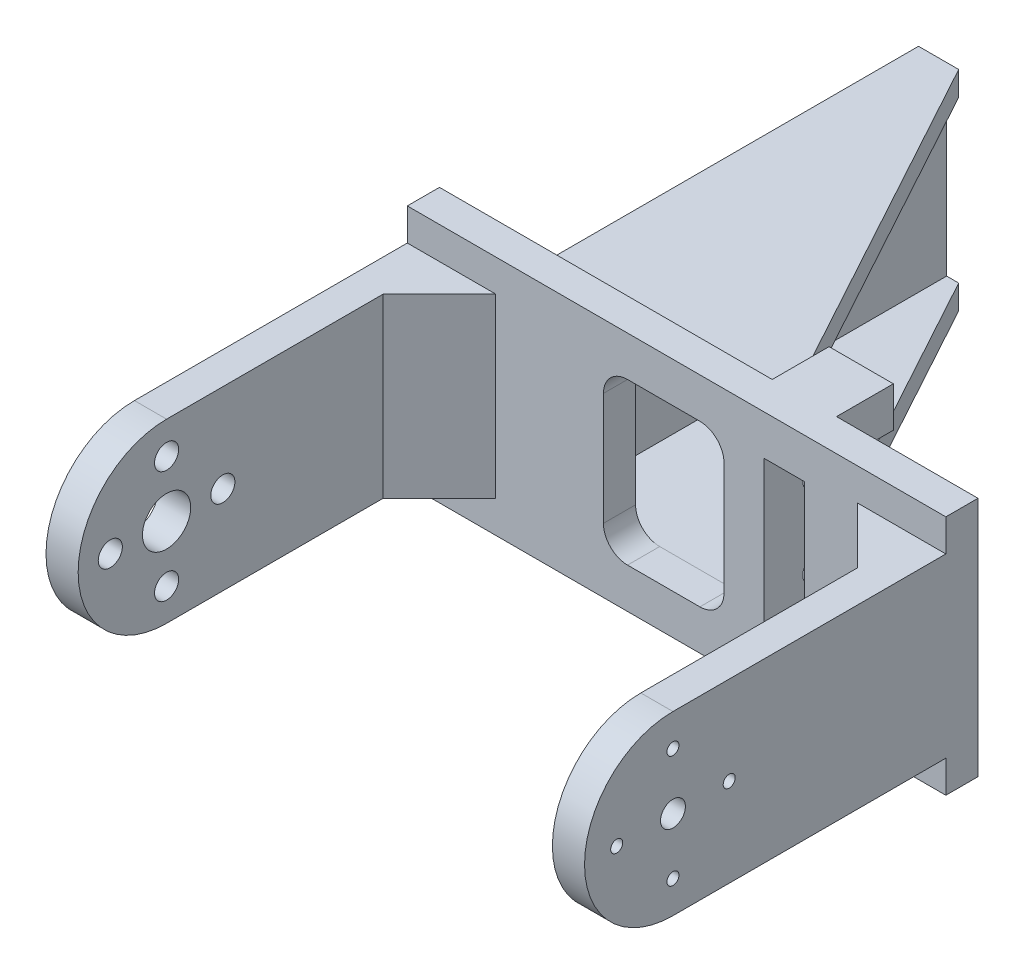
from build123d import *

# Parameters (mm, degrees)
BOSS_EXTRUDE1_DEPTH      = 22
SKETCH3_R                = 1.55
CUT_EXTRUDE1_DEPTH       = 30
CUT_EXTRUDE5_DEPTH       = 9
SKETCH11_R               = 0.75
CUT_EXTRUDE10_DEPTH      = 13
CUT_EXTRUDE11_START      = -10
CUT_EXTRUDE11_DEPTH      = 10
SKETCH13_R               = 3
SKETCH13_R_2             = 1.5
CUT_EXTRUDE12_DEPTH      = 4
FILLET1_SIZE             = 7
SKETCH14_W               = 54
SKETCH14_H               = 9.3
SKETCH14_W_2             = 7.05
SKETCH14_H_2             = 4
BOSS_EXTRUDE4_DEPTH      = 4
SKETCH17_W               = 7.05
SKETCH17_H               = 4
BOSS_EXTRUDE5_DEPTH      = 23.05
BOSS_EXTRUDE6_DEPTH      = 27.3
BOSS_EXTRUDE6_DEPTH_BACK = 4
SKETCH18_W               = 54
SKETCH18_H               = 2.95
SKETCH19_W               = 54
SKETCH19_H               = 2.8
BOSS_EXTRUDE7_DEPTH      = 21
FILLET2_SIZE             = 6.5
FILLET3_SIZE             = 0.5
SKETCH20_R               = 3.970030919
BOSS_EXTRUDE8_DEPTH      = 6
FILLET4_R                = 1
CUT_EXTRUDE13_START      = -37.3
CUT_EXTRUDE13_DEPTH      = 37.3
SKETCH22_W               = 56.118071471
SKETCH22_H               = 11.813110758
CUT_EXTRUDE14_DEPTH      = 56
BOSS_EXTRUDE9_DEPTH      = 4
BOSS_EXTRUDE9_DEPTH_BACK = 26
SKETCH23_W               = 67
SKETCH23_H               = 4
SKETCH25_W               = 5
SKETCH25_H               = 30
BOSS_EXTRUDE10_DEPTH     = 7.07
SKETCH26_W               = 5
SKETCH26_H               = 5
BOSS_EXTRUDE11_DEPTH     = 7.07
SKETCH27_R               = 1.5
CUT_EXTRUDE15_DEPTH      = 7.07
SKETCH28_W               = 5
SKETCH28_H               = 20
SKETCH28_W_2             = 15
CUT_EXTRUDE16_DEPTH      = 7.07
SKETCH29_W               = 3.5
SKETCH29_H               = 30
BOSS_EXTRUDE12_DEPTH     = 47
SKETCH31_W               = 3.5
SKETCH31_H               = 2
CUT_EXTRUDE18_DEPTH      = 47
FILLET8_R                = 3
SKETCH34_W               = 47
SKETCH34_H               = 2.99
BOSS_EXTRUDE14_DEPTH     = 23.3
CUT_EXTRUDE19_DEPTH      = 38
CUT_EXTRUDE20_DEPTH      = 7.07
SKETCH37_R               = 2.5
BOSS_EXTRUDE15_DEPTH     = 7
FILLET10_R               = 0.5


# Read off the part's stored shape, not the designer's step: Cut-Extrude13
with BuildPart() as part:
    # Sketch1 → Boss-Extrude1 (new body)
    with BuildSketch(Plane(origin=(0, 0, 0), x_dir=(1, 0, 0), z_dir=(0, 1, 0))):
        Polygon((0, 0), (0, 50), (67, 50), (67, 0), (63, 0), (63, 46), (4, 46), (4, 0), align=None)
    extrude(amount=BOSS_EXTRUDE1_DEPTH)

    # Sketch3 → Cut-Extrude1 (cut)
    with BuildSketch(Plane(origin=(67, 0, 0), x_dir=(0, 0, -1), z_dir=(1, 0, 0))):
        with Locations((12.05, 11)):
            Circle(SKETCH3_R)
    extrude(amount=-CUT_EXTRUDE1_DEPTH, mode=Mode.SUBTRACT)

    # Sketch5 → Cut-Extrude5 (cut)
    with BuildSketch(Plane(origin=(67, 0, 0), x_dir=(0, 0, -1), z_dir=(1, 0, 0))):
        with BuildLine():
            Line((12.05, 22), (0, 22))
            Line((0, 22), (0, 0))
            Line((0, 0), (12.05, 0))
            ThreePointArc((12.05, 0), (1.05, 11), (12.05, 22))
        make_face()
    extrude(amount=-CUT_EXTRUDE5_DEPTH, mode=Mode.SUBTRACT)

    # Sketch11 → Cut-Extrude10 (cut)
    with BuildSketch(Plane(origin=(67, 0, 0), x_dir=(0, 0, -1), z_dir=(1, 0, 0))):
        with Locations((19.05, 11)):
            Circle(SKETCH11_R)
        with Locations((12.05, 18)):
            Circle(SKETCH11_R)
        with Locations((12.05, 4)):
            Circle(SKETCH11_R)
        with Locations((5.05, 11)):
            Circle(SKETCH11_R)
    extrude(amount=-CUT_EXTRUDE10_DEPTH, mode=Mode.SUBTRACT)

    # Sketch12 → Cut-Extrude11 (cut)
    with BuildSketch(Plane.ZY.offset(CUT_EXTRUDE11_START)):
        with BuildLine():
            Line((-12.05, 22), (0, 22))
            Line((0, 22), (0, 0))
            Line((0, 0), (-12.05, 0))
            ThreePointArc((-12.05, 0), (-1.05, 11), (-12.05, 22))
        make_face()
    extrude(amount=CUT_EXTRUDE11_DEPTH, mode=Mode.SUBTRACT)

    # Sketch13 → Cut-Extrude12 (cut)
    with BuildSketch(Plane.ZY):
        with Locations((-12.05, 11)):
            Circle(SKETCH13_R)
        with Locations((-19.05, 11)):
            Circle(SKETCH13_R_2)
        with Locations((-12.05, 4)):
            Circle(SKETCH13_R_2)
        with Locations((-5.05, 11)):
            Circle(SKETCH13_R_2)
        with Locations((-12.05, 18)):
            Circle(SKETCH13_R_2)
    extrude(amount=-CUT_EXTRUDE12_DEPTH, mode=Mode.SUBTRACT)

    # Fillet1
    fillet1_edges = [part.edges().sort_by_distance(p)[0] for p in [
        (63, 11, -46),
        (4, 11, -46),
    ]]
    chamfer(fillet1_edges, length=FILLET1_SIZE)

    # Sketch14 → Boss-Extrude4 (add)
    with BuildSketch(Plane(origin=(0, 0, -50), x_dir=(-1, 0, 0), z_dir=(0, 0, -1))):
        with Locations((-33.5, -4.65)):
            Rectangle(SKETCH14_W, SKETCH14_H)
        with Locations((-56.975, 20)):
            Rectangle(SKETCH14_W_2, SKETCH14_H_2)
        with Locations((-10.025, 20)):
            Rectangle(SKETCH14_W_2, SKETCH14_H_2)
    extrude(amount=-BOSS_EXTRUDE4_DEPTH)

    # Sketch17 → Boss-Extrude5 (add)
    with BuildSketch(Plane(origin=(0, 0, -50), x_dir=(-1, 0, 0), z_dir=(0, 0, -1))):
        with Locations((-56.975, 20)):
            Rectangle(SKETCH17_W, SKETCH17_H)
        with Locations((-10.025, 20)):
            Rectangle(SKETCH17_W, SKETCH17_H)
    extrude(amount=BOSS_EXTRUDE5_DEPTH)

    # Sketch18 → Boss-Extrude6 (add, two sides: drawn at the far end of the back side and taken through both)
    with BuildSketch(Plane.XZ.offset(-18).offset(-BOSS_EXTRUDE6_DEPTH_BACK)):
        with Locations((33.5, -71.575)):
            Rectangle(SKETCH18_W, SKETCH18_H)
    extrude(amount=BOSS_EXTRUDE6_DEPTH + BOSS_EXTRUDE6_DEPTH_BACK)

    # Sketch19 → Boss-Extrude7 (add)
    with BuildSketch(Plane(origin=(0, 0, -50), x_dir=(-1, 0, 0), z_dir=(0, 0, -1))):
        with Locations((-33.5, -7.9)):
            Rectangle(SKETCH19_W, SKETCH19_H)
    extrude(amount=BOSS_EXTRUDE7_DEPTH)

    # Fillet2
    fillet2_edges = [part.edges().sort_by_distance(p)[0] for p in [
        (60.5, 20, -50),
        (6.5, 20, -50),
    ]]
    chamfer(fillet2_edges, length=FILLET2_SIZE - 0.0001)  # a hair under: the kernel refuses the full size

    # Fillet3
    fillet3_edges = [part.edges().sort_by_distance(p)[0] for p in [
        (60.5, 6.35, -73.05),
        (6.5, 6.35, -73.05),
    ]]
    chamfer(fillet3_edges, length=FILLET3_SIZE)

    # Sketch20 → Boss-Extrude8 (add)
    with BuildSketch(Plane.XZ.offset(9.3)):
        with Locations(Location((23.4, -59.65, 0), (0, 0, 270))):
            Circle(SKETCH20_R)
    extrude(amount=BOSS_EXTRUDE8_DEPTH)

    # Fillet4
    fillet4_edges = [part.edges().sort_by_distance(p)[0] for p in [
        (23.4, -15.3, -55.679969081),
    ]]
    fillet(fillet4_edges, radius=FILLET4_R)

    # Cut-Extrude13 outline → Cut-Extrude13 (cut)
    with BuildSketch(Plane(origin=(0, 22, 0), x_dir=(1, 0, 0), z_dir=(0, 1, 0)).offset(CUT_EXTRUDE13_START)):
        Polygon((67, 50), (60.5, 56.5), (60.5, 72.55), (60, 73.05), (7, 73.05), (6.5, 72.55), (6.5, 56.5), (0, 50), align=None)
    extrude(amount=CUT_EXTRUDE13_DEPTH, mode=Mode.SUBTRACT)

    # Sketch22 → Cut-Extrude14 (cut)
    with BuildSketch(Plane(origin=(0, 0, -50), x_dir=(-1, 0, 0), z_dir=(0, 0, -1))):
        with Locations((-32.440964265, -5.906555379)):
            Rectangle(SKETCH22_W, SKETCH22_H)
    extrude(amount=-CUT_EXTRUDE14_DEPTH, mode=Mode.SUBTRACT)

    # Sketch23 → Boss-Extrude9 (add, two sides: drawn at the far end of the back side and taken through both)
    with BuildSketch(Plane(origin=(0, 22, 0), x_dir=(1, 0, 0), z_dir=(0, 1, 0)).offset(-BOSS_EXTRUDE9_DEPTH_BACK)):
        with Locations((33.5, 48)):
            Rectangle(SKETCH23_W, SKETCH23_H)
    extrude(amount=BOSS_EXTRUDE9_DEPTH + BOSS_EXTRUDE9_DEPTH_BACK)

    # Sketch25 → Boss-Extrude10 (add)
    with BuildSketch(Plane(origin=(0, 0, -50), x_dir=(-1, 0, 0), z_dir=(0, 0, -1))):
        with Locations((-41.9, 11)):
            Rectangle(SKETCH25_W, SKETCH25_H)
    extrude(amount=BOSS_EXTRUDE10_DEPTH)

    # Sketch26 → Boss-Extrude11 (add)
    with BuildSketch(Plane(origin=(0, 0, -50), x_dir=(-1, 0, 0), z_dir=(0, 0, -1))):
        with Locations((-46.9, 23.5)):
            Rectangle(SKETCH26_W, SKETCH26_H)
        with Locations((-46.9, -1.5)):
            Rectangle(SKETCH26_W, SKETCH26_H)
    extrude(amount=BOSS_EXTRUDE11_DEPTH)

    # Sketch27 → Cut-Extrude15 (cut)
    with BuildSketch(Plane(origin=(44.4, 0, 0), x_dir=(0, 0, -1), z_dir=(1, 0, 0))):
        with Locations((52.3, 6)):
            Circle(SKETCH27_R)
        with Locations((52.3, 16.11)):
            Circle(SKETCH27_R)
    extrude(amount=-CUT_EXTRUDE15_DEPTH, mode=Mode.SUBTRACT)

    # Sketch28 → Cut-Extrude16 (cut)
    with BuildSketch(Plane(origin=(0, 0, -50), x_dir=(-1, 0, 0), z_dir=(0, 0, -1))):
        with Locations((-46.9, 11)):
            Rectangle(SKETCH28_W, SKETCH28_H)
        with Locations((-31.9, 11)):
            Rectangle(SKETCH28_W_2, SKETCH28_H)
    extrude(amount=-CUT_EXTRUDE16_DEPTH, mode=Mode.SUBTRACT)

    # Sketch29 → Boss-Extrude12 (add)
    with BuildSketch(Plane(origin=(0, 0, -50), x_dir=(-1, 0, 0), z_dir=(0, 0, -1))):
        with Locations((-14.35, 11)):
            Rectangle(SKETCH29_W, SKETCH29_H)
    extrude(amount=BOSS_EXTRUDE12_DEPTH)

    # Sketch31 → Cut-Extrude18 (cut)
    with BuildSketch(Plane(origin=(0, 0, -97), x_dir=(-1, 0, 0), z_dir=(0, 0, -1))):
        with Locations((-14.35, 25)):
            Rectangle(SKETCH31_W, SKETCH31_H)
        with Locations((-14.35, -3)):
            Rectangle(SKETCH31_W, SKETCH31_H)
    extrude(amount=-CUT_EXTRUDE18_DEPTH, mode=Mode.SUBTRACT)

    # Fillet8
    fillet8_edges = [part.edges().sort_by_distance(p)[0] for p in [
        (39.4, 1, -48),
        (39.4, 21, -48),
        (24.4, 21, -48),
        (24.4, 1, -48),
    ]]
    fillet(fillet8_edges, radius=FILLET8_R)

    # Sketch34 → Boss-Extrude14 (add)
    with BuildSketch(Plane(origin=(16.1, 0, 0), x_dir=(0, 0, -1), z_dir=(1, 0, 0))):
        with Locations((73.5, 22.505)):
            Rectangle(SKETCH34_W, SKETCH34_H)
        with Locations((73.5, -0.505)):
            Rectangle(SKETCH34_W, SKETCH34_H)
    extrude(amount=BOSS_EXTRUDE14_DEPTH)

    # Sketch35 → Cut-Extrude19 (cut)
    with BuildSketch(Plane.XZ.offset(2)):
        Polygon((39.4, -57.07), (17.6, -97), (39.4, -97), align=None)
    extrude(amount=-CUT_EXTRUDE19_DEPTH, mode=Mode.SUBTRACT)

    # Sketch36 → Cut-Extrude20 (cut)
    with BuildSketch(Plane(origin=(0, 0, -57.07), x_dir=(-1, 0, 0), z_dir=(0, 0, -1))):
        Polygon((-39.4, 24), (-41.4, 26), (-39.4, 26), align=None)
        Polygon((-39.4, -2), (-39.4, -4), (-41.4, -4), align=None)
    extrude(amount=-CUT_EXTRUDE20_DEPTH, mode=Mode.SUBTRACT)

    # Sketch37 → Boss-Extrude15 (add)
    with BuildSketch(Plane.ZY.offset(-12.6)):
        with Locations(Location((-87.1, 11, 0), (0, 0, 90))):
            Circle(SKETCH37_R)
    extrude(amount=BOSS_EXTRUDE15_DEPTH)

    # Fillet10
    fillet10_edges = [part.edges().sort_by_distance(p)[0] for p in [
        (5.6, 8.5, -87.1),
    ]]
    fillet(fillet10_edges, radius=FILLET10_R)


solid = part.part
